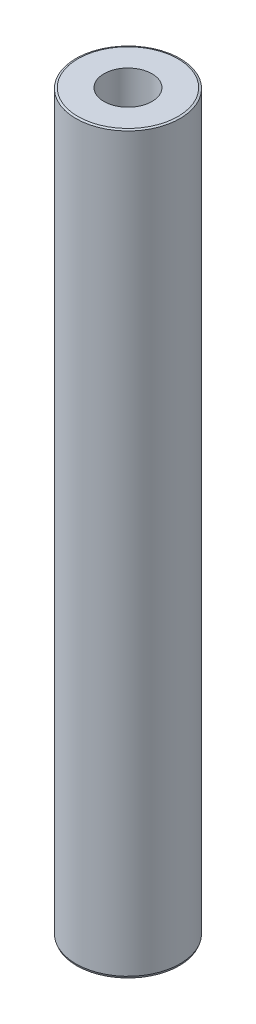
from build123d import *
from OCP.BRepFilletAPI import BRepFilletAPI_MakeChamfer

# Parameters (mm, degrees)
SKETCH1_R           = 42.5
BOSS_EXTRUDE1_DEPTH = 600
SKETCH2_R           = 19.629803058
CUT_EXTRUDE1_DEPTH  = 604.002902149
CHAMFER1_SIZE       = 0.613159264
CHAMFER1_SIZE2      = 1.650818584


with BuildPart() as part:
    # Sketch1 → Boss-Extrude1 (new body)
    with BuildSketch(Plane(origin=(0, 0, 0), x_dir=(1, 0, 0), z_dir=(0, 1, 0))):
        Circle(SKETCH1_R)
    extrude(amount=BOSS_EXTRUDE1_DEPTH)

    # Sketch2 → Cut-Extrude1 (cut, through all)
    with BuildSketch(Plane(origin=(0, 0, 0), x_dir=(1, 0, 0), z_dir=(0, 1, 0))):
        Circle(SKETCH2_R)
    extrude(amount=CUT_EXTRUDE1_DEPTH, mode=Mode.SUBTRACT)

    # Chamfer1: one chamfer whose edges measure the first distance from different faces: ONE call of the kernel's chamfer builder (chamfer() names one face for all edges)
    chamfer1_edges_1 = [part.edges().sort_by_distance(p)[0] for p in [
        (-42.5, 600, 0),
    ]]
    chamfer1_side_1 = [part.faces().sort_by_distance(p)[0] for p in [
        (-42.5, 300, 0),
    ]]
    chamfer1_edges_2 = [part.edges().sort_by_distance(p)[0] for p in [
        (-42.5, 0, 0),
    ]]
    chamfer1_side_2 = [part.faces().sort_by_distance(p)[0] for p in [
        (-41.297918472, 0, 0),
    ]]
    chamfer1 = BRepFilletAPI_MakeChamfer(part.part.solid().wrapped)
    for e in chamfer1_edges_1:
        chamfer1.Add(CHAMFER1_SIZE, CHAMFER1_SIZE2, e.wrapped, chamfer1_side_1[0].wrapped)  # the first distance lies on this face
    for e in chamfer1_edges_2:
        chamfer1.Add(CHAMFER1_SIZE, CHAMFER1_SIZE2, e.wrapped, chamfer1_side_2[0].wrapped)  # the first distance lies on this face
    add(Compound.cast(chamfer1.Shape()), mode=Mode.REPLACE)


solid = part.part
